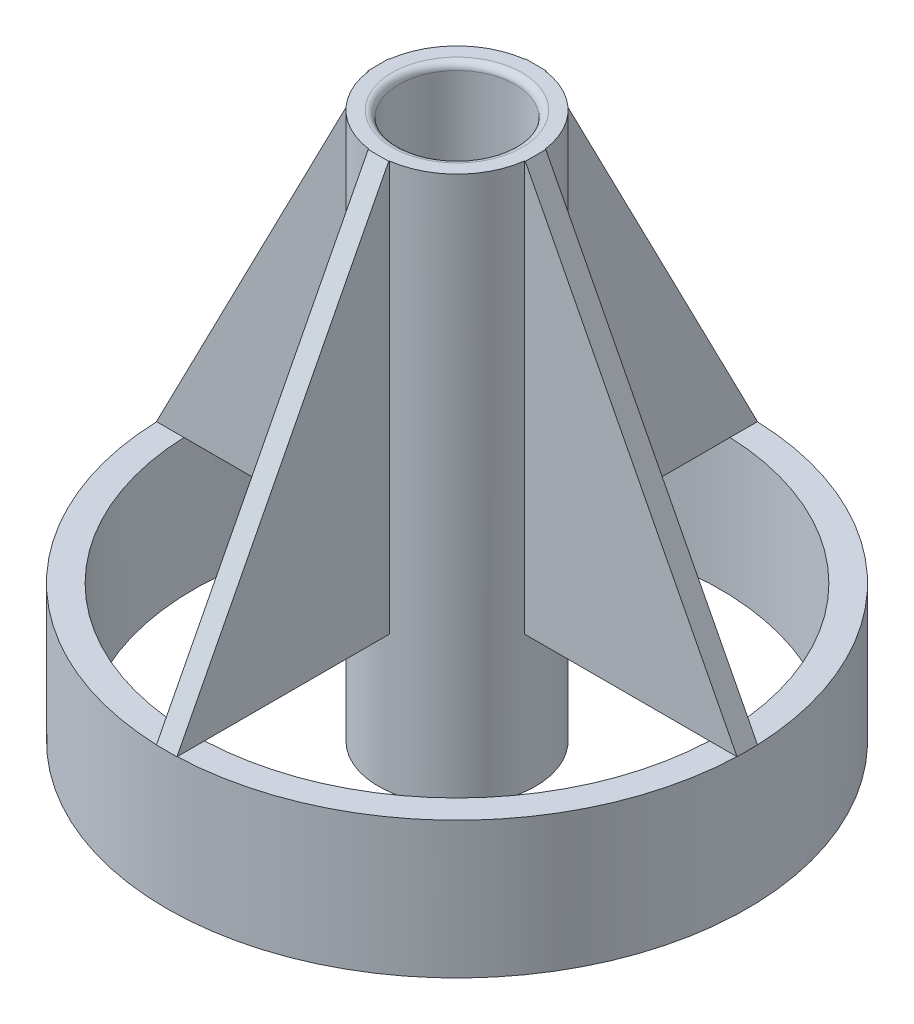
from build123d import *

# Parameters (mm, degrees)
SKETCH1_R           = 21.25
SKETCH1_R_2         = 19.25
BOSS_EXTRUDE1_DEPTH = 10
SKETCH2_R           = 5.75
SKETCH2_R_2         = 4.25
BOSS_EXTRUDE2_DEPTH = 30
BOSS_EXTRUDE3_DEPTH = 0.75
CIRPATTERN1_COUNT   = 4
FILLET1_R           = 0.5
BOSS_EXTRUDE4_START = 10
SKETCH4_R           = 5.75
SKETCH4_R_2         = 4.25
BOSS_EXTRUDE4_DEPTH = 10
FILLET2_R           = 0.5


with BuildPart() as part:
    # Sketch1 → Boss-Extrude1 (new body)
    with BuildSketch(Plane(origin=(0, 0, 0), x_dir=(1, 0, 0), z_dir=(0, 1, 0))):
        Circle(SKETCH1_R)
        Circle(SKETCH1_R_2, mode=Mode.SUBTRACT)
    extrude(amount=BOSS_EXTRUDE1_DEPTH)



with BuildPart() as body_2:
    # Sketch2 → Boss-Extrude2 (new body)
    with BuildSketch(Plane(origin=(0, 10, 0), x_dir=(1, 0, 0), z_dir=(0, 1, 0))):
        Circle(SKETCH2_R)
        Circle(SKETCH2_R_2, mode=Mode.SUBTRACT)
    extrude(amount=BOSS_EXTRUDE2_DEPTH)


with BuildPart() as part_1:
    add(part.part)

    add(body_2.part)  # Boss-Extrude3 merges body 2
    # Sketch3 → Boss-Extrude3 (add, symmetric)
    with BuildSketch(Plane.XY):
        Polygon((-21.25, 10), (-5.75, 40), (-4.25, 40), (-4.25, 10), (-5.75, 10), align=None)
    boss_extrude3 = extrude(amount=BOSS_EXTRUDE3_DEPTH, both=True)

    # CirPattern1: Boss-Extrude3 ×4 about axis
    cirpattern1_axis = Axis((0, 40, 0), (0, -1, 0))
    for i in range(1, CIRPATTERN1_COUNT):
        add(boss_extrude3.rotate(cirpattern1_axis, i * 360 / CIRPATTERN1_COUNT))

    # Fillet1
    fillet1_edges = [part_1.edges().sort_by_distance(p)[0] for p in [
        (-4.25, 40, 0),
    ]]
    fillet(fillet1_edges, radius=FILLET1_R)

    # Sketch4 → Boss-Extrude4 (add)
    with BuildSketch(Plane.XZ.offset(-10).offset(BOSS_EXTRUDE4_START)):
        Circle(SKETCH4_R)
        Circle(SKETCH4_R_2, mode=Mode.SUBTRACT)
    extrude(amount=-BOSS_EXTRUDE4_DEPTH)

    # Fillet2
    fillet2_edges = [part_1.edges().sort_by_distance(p)[0] for p in [
        (-4.25, 0, 0),
    ]]
    fillet(fillet2_edges, radius=FILLET2_R)


solid = part_1.part
